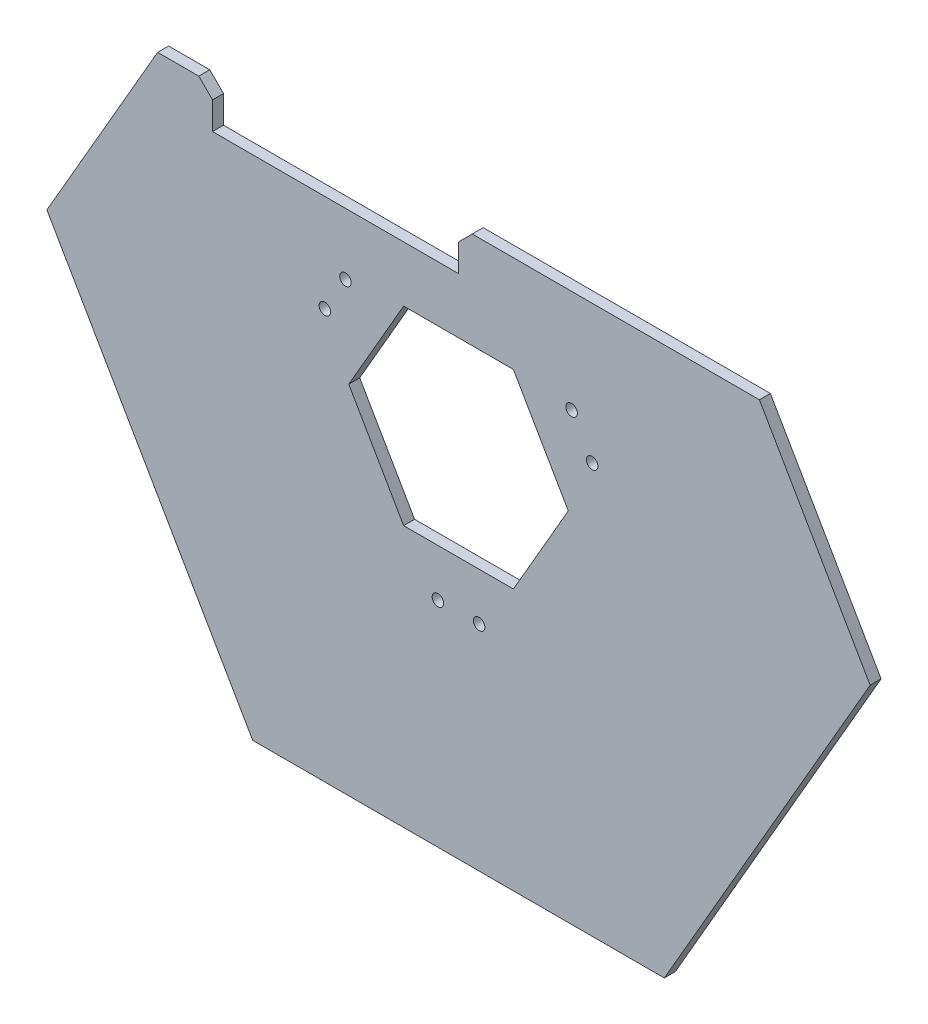
from build123d import *

# Parameters (mm, degrees)
EXTRUDE_1_DEPTH          = 4
CUT_EXTRUDE_1_REACH      = 200.472
SKETCH_2_R               = 2.1
CUT_EXTRUDE_2_DEPTH      = 199.471660446
CUT_EXTRUDE_2_DEPTH_BACK = 4
CUT_EXTRUDE_3_REACH      = 200.472
PATTERN_CIRCULAR_1_COUNT = 3
CHAMFER_1_SIZE           = 5


with BuildPart() as part:
    # 草圖1 → 填料-伸長1 (new body)
    with BuildSketch(Plane.XY):
        Polygon((150, 0), (75, 129.903810568), (-75, 129.903810568), (-150, 0), (-75, -129.903810568), (75, -129.903810568), align=None)
    extrude(amount=EXTRUDE_1_DEPTH)

    # 草圖2 → 除料-伸長1 (cut, up to next)
    with BuildSketch(Plane.XY.offset(4), mode=Mode.PRIVATE) as cut_extrude_1_sk1:
        with Locations((-7.5, -51.903810568)):
            Circle(SKETCH_2_R)
    cut_extrude_1_tool1 = extrude(cut_extrude_1_sk1.sketch, amount=-CUT_EXTRUDE_1_REACH, mode=Mode.PRIVATE) & part.part
    # 草圖2 → 除料-伸長1 (cut, up to next)
    with BuildSketch(Plane.XY.offset(4), mode=Mode.PRIVATE) as cut_extrude_1_sk2:
        with Locations((7.5, -51.903810568)):
            Circle(SKETCH_2_R)
    cut_extrude_1_tool2 = extrude(cut_extrude_1_sk2.sketch, amount=-CUT_EXTRUDE_1_REACH, mode=Mode.PRIVATE) & part.part
    cut_extrude_1_1 = cut_extrude_1_tool1.solids().sort_by_distance((-7.5, -51.903811, 4))[0]
    add(cut_extrude_1_1, mode=Mode.SUBTRACT)
    cut_extrude_1_2 = cut_extrude_1_tool2.solids().sort_by_distance((7.5, -51.903811, 4))[0]
    add(cut_extrude_1_2, mode=Mode.SUBTRACT)
    cut_extrude_1 = cut_extrude_1_1 + cut_extrude_1_2  # 除料-伸長1 as one shape, for the pattern or mirror that repeats it

    # 草圖3 → 除料-伸長2 (cut, two sides: drawn at the far end of the back side and taken through both)
    with BuildSketch(Plane.XY.offset(4).offset(-CUT_EXTRUDE_2_DEPTH_BACK)):
        Polygon((-774.886138932, 69.903810568), (-109.641016151, 69.903810568), (-89.641016151, 69.903810568), (-89.641016151, 54.903810568), (0, 54.903810568), (0, 69.903810568), (109.641016151, 69.903810568), (774.886138932, 69.903810568), (774.886138932, 1400.394056128), (-774.886138932, 1400.394056128), align=None)
    extrude(amount=CUT_EXTRUDE_2_DEPTH + CUT_EXTRUDE_2_DEPTH_BACK, mode=Mode.SUBTRACT)

    # 草圖4 → 除料-伸長3 (cut, up to next)
    with BuildSketch(Plane.XY.offset(4), mode=Mode.PRIVATE) as cut_extrude_3_sk1:
        Polygon((40, 0), (20, 34.641016151), (-20, 34.641016151), (-40, 0), (-20, -34.641016151), (20, -34.641016151), align=None)
    cut_extrude_3_tool1 = extrude(cut_extrude_3_sk1.sketch, amount=-CUT_EXTRUDE_3_REACH, mode=Mode.PRIVATE) & part.part
    add(cut_extrude_3_tool1.solids().sort_by_distance((0, 0, 4))[0], mode=Mode.SUBTRACT)

    # 環狀複製排列1: 除料-伸長1 ×3 about axis
    pattern_circular_1_axis = Axis((0, 0, 0), (0, 0, 1))
    for i in range(1, PATTERN_CIRCULAR_1_COUNT):
        add(cut_extrude_1.rotate(pattern_circular_1_axis, i * 360 / PATTERN_CIRCULAR_1_COUNT), mode=Mode.SUBTRACT)

    # 導角1
    chamfer_1_edges = [part.edges().sort_by_distance(p)[0] for p in [
        (0, 69.903810568, 2),
        (-89.641016151, 69.903810568, 2),
    ]]
    chamfer(chamfer_1_edges, length=CHAMFER_1_SIZE)


solid = part.part
